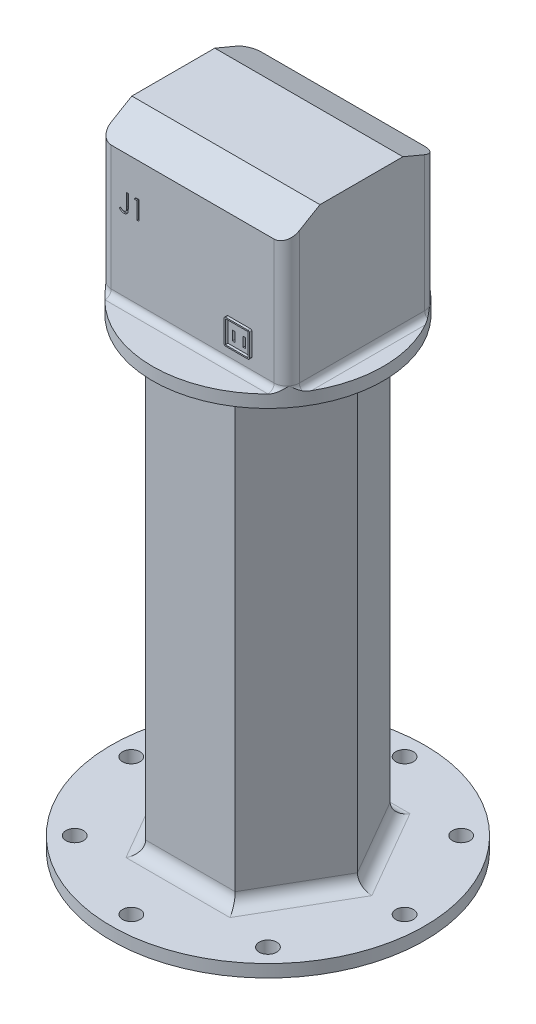
from build123d import *

# Parameters (mm, degrees)
BOSS_EXTRUDE1_DEPTH      = 60
BOSS_EXTRUDE1_DEPTH_BACK = 60
SKETCH1_W                = 150
SKETCH1_H                = 120
SKETCH3_R                = 12.5
CUT_EXTRUDE2_DEPTH       = 10
SKETCH4_W                = 150
SKETCH4_H                = 120
BOSS_EXTRUDE2_DEPTH      = 2
CUT_EXTRUDE4_DEPTH       = 1
CUT_EXTRUDE5_DEPTH       = 177
FILLET1_R                = 10
SKETCH8_W                = 18
SKETCH8_H                = 18
BOSS_EXTRUDE3_DEPTH      = 2
SKETCH9_W                = 2
SKETCH9_H                = 7.57164079
CUT_EXTRUDE6_DEPTH       = 8
SKETCH10_R               = 92.006097334
BOSS_EXTRUDE4_DEPTH      = 10
BOSS_EXTRUDE5_DEPTH      = 360
SKETCH12_R               = 125
BOSS_EXTRUDE6_DEPTH      = 10
SKETCH13_R               = 7
CUT_EXTRUDE7_DEPTH       = 10
FILLET2_R                = 10
FILLET3_R                = 10
FILLET4_R                = 5


with BuildPart() as part:
    # Sketch1 → Boss-Extrude1 (new, two sides: drawn at the far end of the back side and taken through both)
    with BuildSketch(Plane.XY.offset(-BOSS_EXTRUDE1_DEPTH_BACK)):
        Rectangle(SKETCH1_W, SKETCH1_H)
    extrude(amount=BOSS_EXTRUDE1_DEPTH + BOSS_EXTRUDE1_DEPTH_BACK)

    # Sketch2 → Revolve1 (revolve)
    with BuildSketch(Plane.XY, mode=Mode.PRIVATE) as revolve1_sk:
        Polygon((-75, 0), (-80, 0), (-80, -36.1072663), (-75, -44.422332794), align=None)
    revolve(revolve1_sk.sketch.rotate(Axis((-75, 0, 0), (-1, 0, 0)), 180), axis=Axis((-75, 0, 0), (-1, 0, 0)))

    # Sketch3 → Cut-Extrude2 (cut)
    with BuildSketch(Plane.ZY.offset(80)):
        Circle(SKETCH3_R)
    extrude(amount=-CUT_EXTRUDE2_DEPTH, mode=Mode.SUBTRACT)

    # Sketch4 → Boss-Extrude2 (add)
    with BuildSketch(Plane.XZ.offset(60)):
        Rectangle(SKETCH4_W, SKETCH4_H)
        with BuildLine():
            Line((69.944554774, 45.089336278), (69.944554774, -45.089336278))
            ThreePointArc((69.944554774, -45.089336278), (68.254378555, -47.788291939), (65.088313666, -47.446107152))
            Line((65.088313666, -47.446107152), (7.840775046, -2.356770874))
            ThreePointArc((7.840775046, -2.356770874), (6.697016153, 0), (7.840775046, 2.356770874))
            Line((7.840775046, 2.356770874), (65.088313666, 47.446107152))
            ThreePointArc((65.088313666, 47.446107152), (68.254378555, 47.788291939), (69.944554774, 45.089336278))
        make_face(mode=Mode.SUBTRACT)
        with BuildLine():
            Line((1.856241107, -5.280798055), (58.294838855, -49.732995901))
            ThreePointArc((58.294838855, -49.732995901), (59.273232876, -53.072031347), (56.438597748, -55.089766775))
            Line((56.438597748, -55.089766775), (-56.438597748, -55.089766775))
            ThreePointArc((-56.438597748, -55.089766775), (-59.273232876, -53.072031347), (-58.294838855, -49.732995901))
            Line((-58.294838855, -49.732995901), (-1.856241107, -5.280798055))
            ThreePointArc((-1.856241107, -5.280798055), (0, -4.637568929), (1.856241107, -5.280798055))
        make_face(mode=Mode.SUBTRACT)
        with BuildLine():
            Line((-65.088313666, -47.446107152), (-7.840775046, -2.356770874))
            ThreePointArc((-7.840775046, -2.356770874), (-6.697016153, 0), (-7.840775046, 2.356770874))
            Line((-7.840775046, 2.356770874), (-65.088313666, 47.446107152))
            ThreePointArc((-65.088313666, 47.446107152), (-68.254378555, 47.788291939), (-69.944554774, 45.089336278))
            Line((-69.944554774, 45.089336278), (-69.944554774, -45.089336278))
            ThreePointArc((-69.944554774, -45.089336278), (-68.254378555, -47.788291939), (-65.088313666, -47.446107152))
        make_face(mode=Mode.SUBTRACT)
        with BuildLine():
            Line((-56.438597748, 55.089766775), (56.438597748, 55.089766775))
            ThreePointArc((56.438597748, 55.089766775), (59.273232876, 53.072031347), (58.294838855, 49.732995901))
            Line((58.294838855, 49.732995901), (1.856241107, 5.280798055))
            ThreePointArc((1.856241107, 5.280798055), (0, 4.637568929), (-1.856241107, 5.280798055))
            Line((-1.856241107, 5.280798055), (-58.294838855, 49.732995901))
            ThreePointArc((-58.294838855, 49.732995901), (-59.273232876, 53.072031347), (-56.438597748, 55.089766775))
        make_face(mode=Mode.SUBTRACT)
    extrude(amount=BOSS_EXTRUDE2_DEPTH)

    # Sketch6 → Cut-Extrude4 (cut)
    with BuildSketch(Plane.XY.offset(60)):
        with BuildLine():
            Line((-52.704658959, 17.771732573), (-51.358505113, 17.771732573))
            Line((-51.358505113, 17.771732573), (-51.358505113, 7.642525842))
            add(Edge.make_bspline(
                [(-51.358505113, 7.642525842), (-51.359850479, 7.455217967), (-51.362433745, 7.09556399), (-51.376638361, 6.577533008), (-51.402924695, 6.104515781), (-51.441217606, 5.675436723), (-51.492304318, 5.291640057), (-51.550765867, 4.950160267), (-51.621535005, 4.653847342), (-51.728105575, 4.321124389), (-51.902851068, 3.956222369), (-52.16585266, 3.562128866), (-52.492564645, 3.217414249), (-52.870997645, 2.918045428), (-53.304459176, 2.679514437), (-53.784022973, 2.508277959), (-54.306736919, 2.40383143), (-54.669304972, 2.392800408), (-54.856101267, 2.387117188)],
                knots=[0, 0, 0, 0, 1.237770943, 2.376671248, 3.424123796, 4.367912054, 5.222547132, 5.982086412, 6.656319012, 7.234008312, 8.288027371, 9.317870876, 10.352700517, 11.413286737, 12.494591526, 13.606319346, 14.766767577, 16, 16, 16, 16], degree=3))
            add(Edge.make_bspline(
                [(-54.856101267, 2.387117188), (-55.001637088, 2.39174837), (-55.294464799, 2.401066615), (-55.730282123, 2.477016814), (-56.164862019, 2.594085571), (-56.600511086, 2.765525266), (-57.045836406, 2.998692116), (-57.50686932, 3.303769902), (-57.989540139, 3.680190729), (-58.307468508, 3.967495353), (-58.473889728, 4.117886419)],
                knots=[0, 0, 0, 0, 0.848567217, 1.707373443, 2.573483905, 3.470863513, 4.432650262, 5.500696352, 6.691726801, 8, 8, 8, 8], degree=3))
            Line((-58.473889728, 4.117886419), (-57.680620498, 5.271732573))
            add(Edge.make_bspline(
                [(-57.680620498, 5.271732573), (-57.497609016, 5.145529446), (-57.152059476, 4.907241488), (-56.644183301, 4.600698914), (-56.194195502, 4.337876776), (-55.899840013, 4.203938437), (-55.76355319, 4.141924881)],
                knots=[0, 0, 0, 0, 1.196737151, 2.259595785, 3.194191475, 4, 4, 4, 4], degree=3))
            add(Edge.make_bspline(
                [(-55.76355319, 4.141924881), (-55.68090614, 4.109527206), (-55.518816872, 4.045988153), (-55.270995102, 3.97507716), (-55.024587801, 3.936323974), (-54.861226256, 3.929118261), (-54.780981075, 3.925578727)],
                knots=[0, 0, 0, 0, 1.051806502, 2.062826769, 3.048436908, 4, 4, 4, 4], degree=3))
            add(Edge.make_bspline(
                [(-54.780981075, 3.925578727), (-54.677340553, 3.929961876), (-54.472481454, 3.938625747), (-54.174778623, 4.015122641), (-53.889958489, 4.131884369), (-53.628231385, 4.302847056), (-53.387008297, 4.506124573), (-53.187967616, 4.751936039), (-53.022036569, 5.024361685), (-52.92218074, 5.282239344), (-52.858560288, 5.517424903), (-52.818181888, 5.733566913), (-52.782873343, 5.986258964), (-52.752095263, 6.27580268), (-52.734076104, 6.602777746), (-52.71385922, 6.966224073), (-52.706550959, 7.367057982), (-52.70530887, 7.646533491), (-52.704658959, 7.792766227)],
                knots=[0, 0, 0, 0, 0.997221856, 1.971139923, 2.944579524, 3.951425367, 4.971190333, 5.972282193, 6.985401279, 8.033996657, 8.624075553, 9.332086008, 10.151144245, 11.082816738, 12.137127781, 13.306538797, 14.590673636, 16, 16, 16, 16], degree=3))
            Line((-52.704658959, 7.792766227), (-52.704658959, 17.771732573))
        make_face()
        Polygon((-45.670404152, 17.771732573), (-42.896966652, 17.771732573), (-42.896966652, 2.771732573), (-44.243120498, 2.771732573), (-44.243120498, 16.233271034), (-46.550812805, 16.233271034), align=None)
    extrude(amount=-CUT_EXTRUDE4_DEPTH, mode=Mode.SUBTRACT)

    # Sketch7 → Cut-Extrude5 (cut)
    with BuildSketch(Plane.ZY.offset(75)):
        Polygon((-82.412252361, 72.153865788), (68.863978284, 72.153865788), (68.863978284, 39.153865788), (33.542303322, 60), (-32.615265506, 60), (-82.412252361, 39.153865788), align=None)
    extrude(amount=-CUT_EXTRUDE5_DEPTH, mode=Mode.SUBTRACT)

    # Fillet1
    fillet1_edges = [part.edges().sort_by_distance(p)[0] for p in [
        (75, -8.80739725, 60),
        (-75, -6.731931656, -60),
        (-75, -8.80739725, 60),
        (75, -6.731931656, -60),
    ]]
    fillet(fillet1_edges, radius=FILLET1_R)

    # Sketch8 → Boss-Extrude3 (add)
    with BuildSketch(Plane.XY.offset(60)):
        with BuildLine():
            Line((28.10388823, -26.945936523), (46.10388823, -26.945936523))
            ThreePointArc((46.10388823, -26.945936523), (46.810995011, -27.238829742), (47.10388823, -27.945936523))
            Line((47.10388823, -27.945936523), (47.10388823, -45.945936523))
            ThreePointArc((47.10388823, -45.945936523), (46.810995011, -46.653043304), (46.10388823, -46.945936523))
            Line((46.10388823, -46.945936523), (28.10388823, -46.945936523))
            ThreePointArc((28.10388823, -46.945936523), (27.396781449, -46.653043304), (27.10388823, -45.945936523))
            Line((27.10388823, -45.945936523), (27.10388823, -27.945936523))
            ThreePointArc((27.10388823, -27.945936523), (27.396781449, -27.238829742), (28.10388823, -26.945936523))
        make_face()
        with Locations((37.10388823, -36.945936523)):
            Rectangle(SKETCH8_W, SKETCH8_H, mode=Mode.SUBTRACT)
    extrude(amount=BOSS_EXTRUDE3_DEPTH)

    # Sketch9 → Cut-Extrude6 (cut)
    with BuildSketch(Plane.XY.offset(60)):
        with Locations((32.624615346, -38.824456455)):
            Rectangle(SKETCH9_W, SKETCH9_H)
        with Locations((41.24337987, -38.824456455)):
            Rectangle(SKETCH9_W, SKETCH9_H)
    extrude(amount=-CUT_EXTRUDE6_DEPTH, mode=Mode.SUBTRACT)

    # Sketch10 → Boss-Extrude4 (add)
    with BuildSketch(Plane.XZ.offset(60)):
        with Locations(Location((0, 0, 0), (0, 0, 142.431407971))):
            Circle(SKETCH10_R)
    extrude(amount=BOSS_EXTRUDE4_DEPTH)

    # Sketch11 → Boss-Extrude5 (add)
    with BuildSketch(Plane.XZ.offset(70)):
        Polygon((71.339667015, 0), (35.669833508, 61.781963933), (-35.669833508, 61.781963933), (-71.339667015, 0), (-35.669833508, -61.781963933), (35.669833508, -61.781963933), align=None)
    extrude(amount=BOSS_EXTRUDE5_DEPTH)

    # Sketch12 → Boss-Extrude6 (add)
    with BuildSketch(Plane.XZ.offset(430)):
        with Locations(Location((0, 0, 0), (0, 0, 270))):
            Circle(SKETCH12_R)
    extrude(amount=BOSS_EXTRUDE6_DEPTH)

    # Sketch13 → Cut-Extrude7 (cut)
    with BuildSketch(Plane(origin=(0, -430, 0), x_dir=(1, 0, 0), z_dir=(0, 1, 0))):
        with Locations(Location((0, 108.953394475, 0), (0, 0, 270))):
            Circle(SKETCH13_R)
        with Locations(Location((77.041683943, 77.041684118, 0), (0, 0, 270))):
            Circle(SKETCH13_R)
        with Locations(Location((108.9533943, 1.75e-07, 0), (0, 0, 270))):
            Circle(SKETCH13_R)
        with Locations(Location((77.041683943, -77.041683768, 0), (0, 0, 270))):
            Circle(SKETCH13_R)
        with Locations(Location((0, -108.953394125, 0), (0, 0, 270))):
            Circle(SKETCH13_R)
        with Locations(Location((-77.041683943, -77.041683768, 0), (0, 0, 270))):
            Circle(SKETCH13_R)
        with Locations(Location((-108.9533943, 1.75e-07, 0), (0, 0, 270))):
            Circle(SKETCH13_R)
        with Locations(Location((-77.041683943, 77.041684118, 0), (0, 0, 270))):
            Circle(SKETCH13_R)
    extrude(amount=-CUT_EXTRUDE7_DEPTH, mode=Mode.SUBTRACT)

    # Fillet2
    fillet2_edges = [part.edges().sort_by_distance(p)[0] for p in [
        (53.504750261, -430, -30.890981966),
        (53.504750261, -430, 30.890981966),
        (0, -430, 61.781963933),
        (-53.504750261, -430, 30.890981966),
        (-53.504750261, -430, -30.890981966),
        (0, -430, -61.781963933),
    ]]
    fillet(fillet2_edges, radius=FILLET2_R)

    # Fillet3
    fillet3_edges = [part.edges().sort_by_distance(p)[0] for p in [
        (53.504750261, -70, -30.890981966),
        (53.504750261, -70, 30.890981966),
        (0, -70, 61.781963933),
        (-53.504750261, -70, 30.890981966),
        (-53.504750261, -70, -30.890981966),
        (0, -70, -61.781963933),
    ]]
    fillet(fillet3_edges, radius=FILLET3_R)

    # Fillet4
    # the kernel refuses this fillet: 5 mm, written as the material it adds along each edge
    with BuildSketch(Plane(origin=(65, -60, 50), x_dir=(0.7926239891046012, 0, 0.6097107608496908), z_dir=(0.6097107608496908, 0, -0.7926239891046012))) as fillet4_piece_1_section:
        with BuildLine():
            CenterArc((10 + FILLET4_R, -FILLET4_R), FILLET4_R, 90, 90)
            Line((10, -FILLET4_R), (10, 0))
            Line((10, 0), (10 + FILLET4_R, 0))
        make_face()
    fillet4_piece_1 = revolve(axis=Axis((65, -60, 50), (0, -1, 0)), revolution_arc=52.431407971, mode=Mode.PRIVATE)
    fillet4_piece_1 = fillet4_piece_1 & Plane(origin=(0, -58.230141205, 0), x_dir=(-0.7926239891027643, 0, 0.609710760852079), z_dir=(0, 1, 0)) * Cylinder(92.006097334, 60, mode=Mode.PRIVATE)
    add(fillet4_piece_1)
    with BuildSketch(Plane(origin=(75, -60, -50), x_dir=(1, 0, 0), z_dir=(0, 0, 1))) as fillet4_piece_2_section:
        with BuildLine():
            CenterArc((FILLET4_R, FILLET4_R), FILLET4_R, 180, 90)
            Line((0, FILLET4_R), (0, 0))
            Line((0, 0), (FILLET4_R, 0))
        make_face()
    fillet4_piece_2 = extrude(amount=100, mode=Mode.PRIVATE)
    fillet4_piece_2 = fillet4_piece_2 & Plane(origin=(0, -58.880307407, 0), x_dir=(-0.7926239891027643, 0, 0.609710760852079), z_dir=(0, 1, 0)) * Cylinder(92.006097334, 221, mode=Mode.PRIVATE)
    add(fillet4_piece_2)
    with BuildSketch(Plane(origin=(65, -60, -50), x_dir=(0, 0, -1), z_dir=(-1, 0, 0))) as fillet4_piece_3_section:
        with BuildLine():
            CenterArc((10 + FILLET4_R, -FILLET4_R), FILLET4_R, 90, 90)
            Line((10, -FILLET4_R), (10, 0))
            Line((10, 0), (10 + FILLET4_R, 0))
        make_face()
    fillet4_piece_3 = revolve(axis=Axis((65, -60, -50), (0, -1, 0)), revolution_arc=52.43140797, mode=Mode.PRIVATE)
    fillet4_piece_3 = fillet4_piece_3 & Plane(origin=(0, -58.981759744, 0), x_dir=(-0.7926239891027643, 0, 0.609710760852079), z_dir=(0, 1, 0)) * Cylinder(92.006097334, 60, mode=Mode.PRIVATE)
    add(fillet4_piece_3)
    with BuildSketch(Plane(origin=(-65, -60, -60), x_dir=(0, 0, -1), z_dir=(1, 0, 0)), Plane(origin=(65, -60, 60), x_dir=(0, 0, 1), z_dir=(-1, 0, 0))) as fillet4_piece_4:
        with BuildLine():
            CenterArc((FILLET4_R, FILLET4_R), FILLET4_R, 180, 90)
            Line((0, FILLET4_R), (0, 0))
            Line((0, 0), (FILLET4_R, 0))
        make_face()
    extrude(amount=130)
    with BuildSketch(Plane(origin=(-65, -60, -50), x_dir=(0, 0, -1), z_dir=(1, 0, 0))) as fillet4_piece_5_section:
        with BuildLine():
            CenterArc((10 + FILLET4_R, FILLET4_R), FILLET4_R, 180, 90)
            Line((10, FILLET4_R), (10, 0))
            Line((10, 0), (10 + FILLET4_R, 0))
        make_face()
    fillet4_piece_5 = revolve(axis=Axis((-65, -60, -50), (0, 1, 0)), revolution_arc=52.431407971, mode=Mode.PRIVATE)
    fillet4_piece_5 = fillet4_piece_5 & Plane(origin=(0, -58.981760296, 0), x_dir=(-0.7926239891027643, 0, 0.609710760852079), z_dir=(0, 1, 0)) * Cylinder(92.006097334, 60, mode=Mode.PRIVATE)
    add(fillet4_piece_5)
    with BuildSketch(Plane(origin=(-75, -60, 50), x_dir=(-1, 0, 0), z_dir=(0, 0, -1))) as fillet4_piece_6_section:
        with BuildLine():
            CenterArc((FILLET4_R, FILLET4_R), FILLET4_R, 180, 90)
            Line((0, FILLET4_R), (0, 0))
            Line((0, 0), (FILLET4_R, 0))
        make_face()
    fillet4_piece_6 = extrude(amount=100, mode=Mode.PRIVATE)
    fillet4_piece_6 = fillet4_piece_6 & Plane(origin=(0, -58.880307407, 0), x_dir=(-0.7926239891027643, 0, 0.609710760852079), z_dir=(0, 1, 0)) * Cylinder(92.006097334, 221, mode=Mode.PRIVATE)
    add(fillet4_piece_6)
    with BuildSketch(Plane(origin=(-65, -60, 50), x_dir=(0, 0, 1), z_dir=(1, 0, 0))) as fillet4_piece_7_section:
        with BuildLine():
            CenterArc((10 + FILLET4_R, -FILLET4_R), FILLET4_R, 90, 90)
            Line((10, -FILLET4_R), (10, 0))
            Line((10, 0), (10 + FILLET4_R, 0))
        make_face()
    fillet4_piece_7 = revolve(axis=Axis((-65, -60, 50), (0, -1, 0)), revolution_arc=52.43140797, mode=Mode.PRIVATE)
    fillet4_piece_7 = fillet4_piece_7 & Plane(origin=(0, -58.981759744, 0), x_dir=(-0.7926239891027643, 0, 0.609710760852079), z_dir=(0, 1, 0)) * Cylinder(92.006097334, 60, mode=Mode.PRIVATE)
    add(fillet4_piece_7)
    with BuildSketch(Plane(origin=(-65, -60, 50), x_dir=(-0.792623989087707, 0, 0.6097107608716534), z_dir=(0.6097107608716534, 0, 0.792623989087707))) as fillet4_piece_8_section:
        with BuildLine():
            CenterArc((10 + FILLET4_R, -FILLET4_R), FILLET4_R, 90, 90)
            Line((10, -FILLET4_R), (10, 0))
            Line((10, 0), (10 + FILLET4_R, 0))
        make_face()
    fillet4_piece_8 = revolve(axis=Axis((-65, -60, 50), (0, -1, 0)), revolution_arc=37.56859203, mode=Mode.PRIVATE)
    fillet4_piece_8 = fillet4_piece_8 & Plane(origin=(0, -58.680721609, 0), x_dir=(-0.7926239891027643, 0, 0.609710760852079), z_dir=(0, 1, 0)) * Cylinder(92.006097334, 60, mode=Mode.PRIVATE)
    add(fillet4_piece_8)
    with BuildSketch(Plane(origin=(-65, -60, -50), x_dir=(-0.7926239891045994, 0, -0.6097107608496933), z_dir=(0.6097107608496933, 0, -0.7926239891045994))) as fillet4_piece_9_section:
        with BuildLine():
            CenterArc((10 + FILLET4_R, FILLET4_R), FILLET4_R, 180, 90)
            Line((10, FILLET4_R), (10, 0))
            Line((10, 0), (10 + FILLET4_R, 0))
        make_face()
    fillet4_piece_9 = revolve(axis=Axis((-65, -60, -50), (0, 1, 0)), revolution_arc=37.568592029, mode=Mode.PRIVATE)
    fillet4_piece_9 = fillet4_piece_9 & Plane(origin=(0, -58.680683606, 0), x_dir=(-0.7926239891027643, 0, 0.609710760852079), z_dir=(0, 1, 0)) * Cylinder(92.006097334, 60, mode=Mode.PRIVATE)
    add(fillet4_piece_9)
    with BuildSketch(Plane(origin=(65, -60, -50), x_dir=(0.7926239890877081, 0, -0.6097107608716518), z_dir=(-0.6097107608716518, 0, -0.7926239890877081))) as fillet4_piece_10_section:
        with BuildLine():
            CenterArc((10 + FILLET4_R, -FILLET4_R), FILLET4_R, 90, 90)
            Line((10, -FILLET4_R), (10, 0))
            Line((10, 0), (10 + FILLET4_R, 0))
        make_face()
    fillet4_piece_10 = revolve(axis=Axis((65, -60, -50), (0, -1, 0)), revolution_arc=37.56859203, mode=Mode.PRIVATE)
    fillet4_piece_10 = fillet4_piece_10 & Plane(origin=(0, -58.680683606, 0), x_dir=(-0.7926239891027643, 0, 0.609710760852079), z_dir=(0, 1, 0)) * Cylinder(92.006097334, 60, mode=Mode.PRIVATE)
    add(fillet4_piece_10)
    with BuildSketch(Plane(origin=(65, -60, 50), x_dir=(1, 0, 0), z_dir=(0, 0, -1))) as fillet4_piece_11_section:
        with BuildLine():
            CenterArc((10 + FILLET4_R, -FILLET4_R), FILLET4_R, 90, 90)
            Line((10, -FILLET4_R), (10, 0))
            Line((10, 0), (10 + FILLET4_R, 0))
        make_face()
    fillet4_piece_11 = revolve(axis=Axis((65, -60, 50), (0, -1, 0)), revolution_arc=37.568592029, mode=Mode.PRIVATE)
    fillet4_piece_11 = fillet4_piece_11 & Plane(origin=(0, -58.680683607, 0), x_dir=(-0.7926239891027643, 0, 0.609710760852079), z_dir=(0, 1, 0)) * Cylinder(92.006097334, 60, mode=Mode.PRIVATE)
    add(fillet4_piece_11)


solid = part.part
